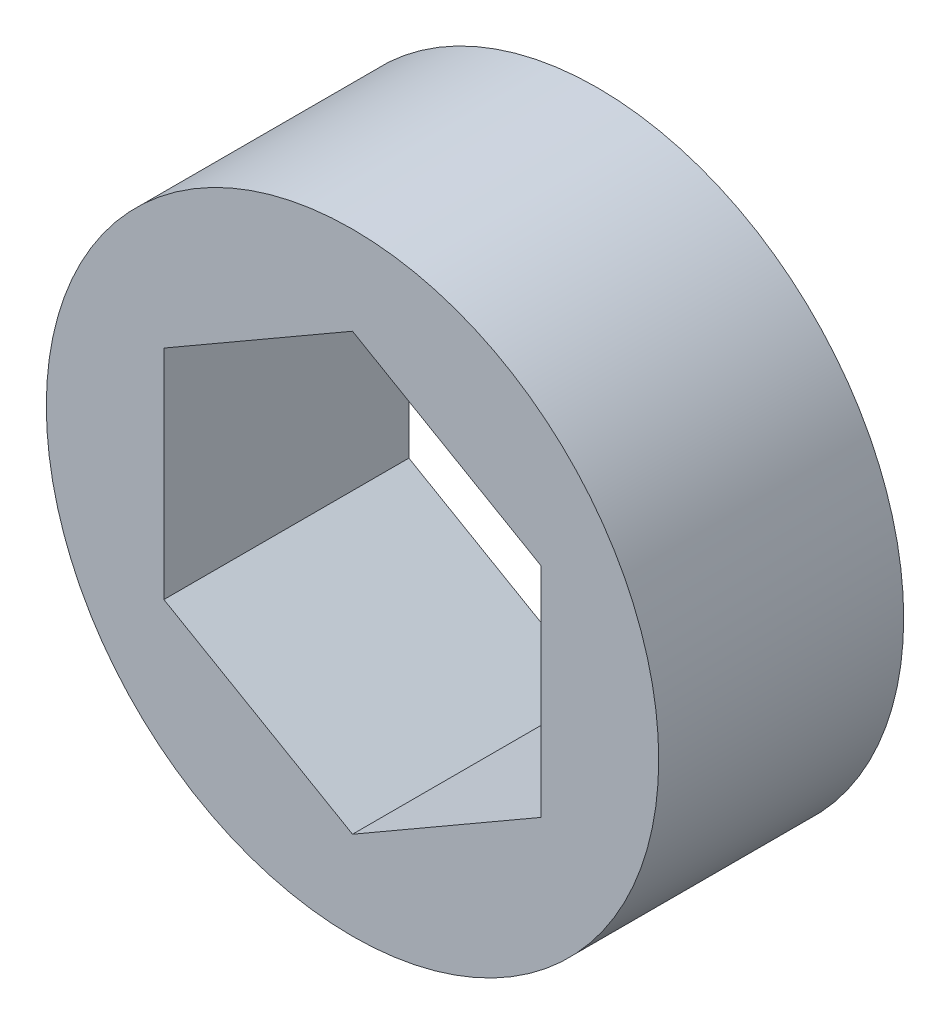
from build123d import *

# Parameters (mm, degrees)
SKETCH1_R           = 7.9375
BOSS_EXTRUDE1_DEPTH = 6.35


with BuildPart() as part:
    # Sketch1 → Boss-Extrude1 (new body)
    with BuildSketch(Plane.XY):
        Circle(SKETCH1_R)
        Polygon((0, 5.645908282), (-4.8895, 2.822954141), (-4.8895, -2.822954141), (0, -5.645908282), (4.8895, -2.822954141), (4.8895, 2.822954141), align=None, mode=Mode.SUBTRACT)
    extrude(amount=BOSS_EXTRUDE1_DEPTH)


solid = part.part
